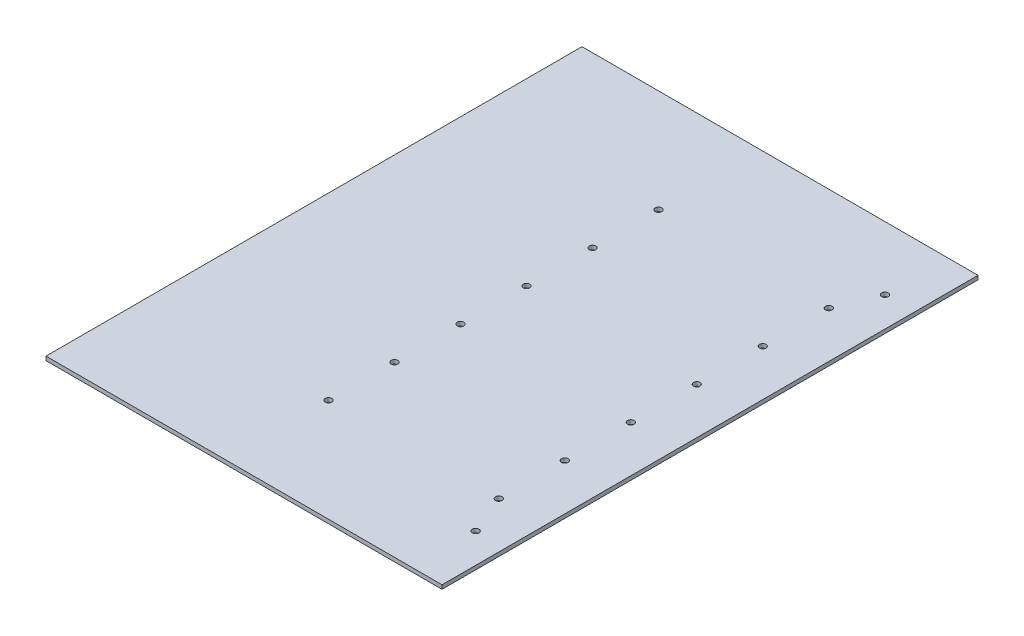
from build123d import *

# Parameters (mm, degrees)
SKETCH1_W           = 300
SKETCH1_H           = 406
BOSS_EXTRUDE1_DEPTH = 3
CUT_EXTRUDE1_REACH  = 254.424
SKETCH2_R           = 2.5
SKETCH3_R           = 2.5
CUT_EXTRUDE2_DEPTH  = 253.424246062


with BuildPart() as part:
    # Sketch1 → Boss-Extrude1 (new body)
    with BuildSketch(Plane(origin=(0, 0, 0), x_dir=(1, 0, 0), z_dir=(0, 1, 0))):
        Rectangle(SKETCH1_W, SKETCH1_H)
    extrude(amount=BOSS_EXTRUDE1_DEPTH)

    # Sketch2 → Cut-Extrude1 (cut, up to next)
    with BuildSketch(Plane(origin=(0, 3, 0), x_dir=(1, 0, 0), z_dir=(0, 1, 0)), mode=Mode.PRIVATE) as cut_extrude1_sk1:
        with Locations((115, 125)):
            Circle(SKETCH2_R)
    cut_extrude1_tool1 = extrude(cut_extrude1_sk1.sketch, amount=-CUT_EXTRUDE1_REACH, mode=Mode.PRIVATE) & part.part
    # Sketch2 → Cut-Extrude1 (cut, up to next)
    with BuildSketch(Plane(origin=(0, 3, 0), x_dir=(1, 0, 0), z_dir=(0, 1, 0)), mode=Mode.PRIVATE) as cut_extrude1_sk2:
        with Locations((115, 75)):
            Circle(SKETCH2_R)
    cut_extrude1_tool2 = extrude(cut_extrude1_sk2.sketch, amount=-CUT_EXTRUDE1_REACH, mode=Mode.PRIVATE) & part.part
    # Sketch2 → Cut-Extrude1 (cut, up to next)
    with BuildSketch(Plane(origin=(0, 3, 0), x_dir=(1, 0, 0), z_dir=(0, 1, 0)), mode=Mode.PRIVATE) as cut_extrude1_sk3:
        with Locations((115, 25)):
            Circle(SKETCH2_R)
    cut_extrude1_tool3 = extrude(cut_extrude1_sk3.sketch, amount=-CUT_EXTRUDE1_REACH, mode=Mode.PRIVATE) & part.part
    # Sketch2 → Cut-Extrude1 (cut, up to next)
    with BuildSketch(Plane(origin=(0, 3, 0), x_dir=(1, 0, 0), z_dir=(0, 1, 0)), mode=Mode.PRIVATE) as cut_extrude1_sk4:
        with Locations((115, -25)):
            Circle(SKETCH2_R)
    cut_extrude1_tool4 = extrude(cut_extrude1_sk4.sketch, amount=-CUT_EXTRUDE1_REACH, mode=Mode.PRIVATE) & part.part
    # Sketch2 → Cut-Extrude1 (cut, up to next)
    with BuildSketch(Plane(origin=(0, 3, 0), x_dir=(1, 0, 0), z_dir=(0, 1, 0)), mode=Mode.PRIVATE) as cut_extrude1_sk5:
        with Locations((115, -75)):
            Circle(SKETCH2_R)
    cut_extrude1_tool5 = extrude(cut_extrude1_sk5.sketch, amount=-CUT_EXTRUDE1_REACH, mode=Mode.PRIVATE) & part.part
    # Sketch2 → Cut-Extrude1 (cut, up to next)
    with BuildSketch(Plane(origin=(0, 3, 0), x_dir=(1, 0, 0), z_dir=(0, 1, 0)), mode=Mode.PRIVATE) as cut_extrude1_sk6:
        with Locations((115, -125)):
            Circle(SKETCH2_R)
    cut_extrude1_tool6 = extrude(cut_extrude1_sk6.sketch, amount=-CUT_EXTRUDE1_REACH, mode=Mode.PRIVATE) & part.part
    # Sketch2 → Cut-Extrude1 (cut, up to next)
    with BuildSketch(Plane(origin=(0, 3, 0), x_dir=(1, 0, 0), z_dir=(0, 1, 0)), mode=Mode.PRIVATE) as cut_extrude1_sk7:
        with Locations((-14, 125)):
            Circle(SKETCH2_R)
    cut_extrude1_tool7 = extrude(cut_extrude1_sk7.sketch, amount=-CUT_EXTRUDE1_REACH, mode=Mode.PRIVATE) & part.part
    # Sketch2 → Cut-Extrude1 (cut, up to next)
    with BuildSketch(Plane(origin=(0, 3, 0), x_dir=(1, 0, 0), z_dir=(0, 1, 0)), mode=Mode.PRIVATE) as cut_extrude1_sk8:
        with Locations((-14, 75)):
            Circle(SKETCH2_R)
    cut_extrude1_tool8 = extrude(cut_extrude1_sk8.sketch, amount=-CUT_EXTRUDE1_REACH, mode=Mode.PRIVATE) & part.part
    # Sketch2 → Cut-Extrude1 (cut, up to next)
    with BuildSketch(Plane(origin=(0, 3, 0), x_dir=(1, 0, 0), z_dir=(0, 1, 0)), mode=Mode.PRIVATE) as cut_extrude1_sk9:
        with Locations((-14, 25)):
            Circle(SKETCH2_R)
    cut_extrude1_tool9 = extrude(cut_extrude1_sk9.sketch, amount=-CUT_EXTRUDE1_REACH, mode=Mode.PRIVATE) & part.part
    # Sketch2 → Cut-Extrude1 (cut, up to next)
    with BuildSketch(Plane(origin=(0, 3, 0), x_dir=(1, 0, 0), z_dir=(0, 1, 0)), mode=Mode.PRIVATE) as cut_extrude1_sk10:
        with Locations((-14, -25)):
            Circle(SKETCH2_R)
    cut_extrude1_tool10 = extrude(cut_extrude1_sk10.sketch, amount=-CUT_EXTRUDE1_REACH, mode=Mode.PRIVATE) & part.part
    # Sketch2 → Cut-Extrude1 (cut, up to next)
    with BuildSketch(Plane(origin=(0, 3, 0), x_dir=(1, 0, 0), z_dir=(0, 1, 0)), mode=Mode.PRIVATE) as cut_extrude1_sk11:
        with Locations((-14, -75)):
            Circle(SKETCH2_R)
    cut_extrude1_tool11 = extrude(cut_extrude1_sk11.sketch, amount=-CUT_EXTRUDE1_REACH, mode=Mode.PRIVATE) & part.part
    # Sketch2 → Cut-Extrude1 (cut, up to next)
    with BuildSketch(Plane(origin=(0, 3, 0), x_dir=(1, 0, 0), z_dir=(0, 1, 0)), mode=Mode.PRIVATE) as cut_extrude1_sk12:
        with Locations((-14, -125)):
            Circle(SKETCH2_R)
    cut_extrude1_tool12 = extrude(cut_extrude1_sk12.sketch, amount=-CUT_EXTRUDE1_REACH, mode=Mode.PRIVATE) & part.part
    add(cut_extrude1_tool1.solids().sort_by_distance((115, 3, -125))[0], mode=Mode.SUBTRACT)
    add(cut_extrude1_tool2.solids().sort_by_distance((115, 3, -75))[0], mode=Mode.SUBTRACT)
    add(cut_extrude1_tool3.solids().sort_by_distance((115, 3, -25))[0], mode=Mode.SUBTRACT)
    add(cut_extrude1_tool4.solids().sort_by_distance((115, 3, 25))[0], mode=Mode.SUBTRACT)
    add(cut_extrude1_tool5.solids().sort_by_distance((115, 3, 75))[0], mode=Mode.SUBTRACT)
    add(cut_extrude1_tool6.solids().sort_by_distance((115, 3, 125))[0], mode=Mode.SUBTRACT)
    add(cut_extrude1_tool7.solids().sort_by_distance((-14, 3, -125))[0], mode=Mode.SUBTRACT)
    add(cut_extrude1_tool8.solids().sort_by_distance((-14, 3, -75))[0], mode=Mode.SUBTRACT)
    add(cut_extrude1_tool9.solids().sort_by_distance((-14, 3, -25))[0], mode=Mode.SUBTRACT)
    add(cut_extrude1_tool10.solids().sort_by_distance((-14, 3, 25))[0], mode=Mode.SUBTRACT)
    add(cut_extrude1_tool11.solids().sort_by_distance((-14, 3, 75))[0], mode=Mode.SUBTRACT)
    add(cut_extrude1_tool12.solids().sort_by_distance((-14, 3, 125))[0], mode=Mode.SUBTRACT)

    # Sketch3 → Cut-Extrude2 (cut, through all)
    with BuildSketch(Plane(origin=(0, 3, 0), x_dir=(1, 0, 0), z_dir=(0, 1, 0))):
        with Locations((127.5, -155)):
            Circle(SKETCH3_R)
        with Locations((127.5, 155)):
            Circle(SKETCH3_R)
    extrude(amount=-CUT_EXTRUDE2_DEPTH, mode=Mode.SUBTRACT)


solid = part.part
